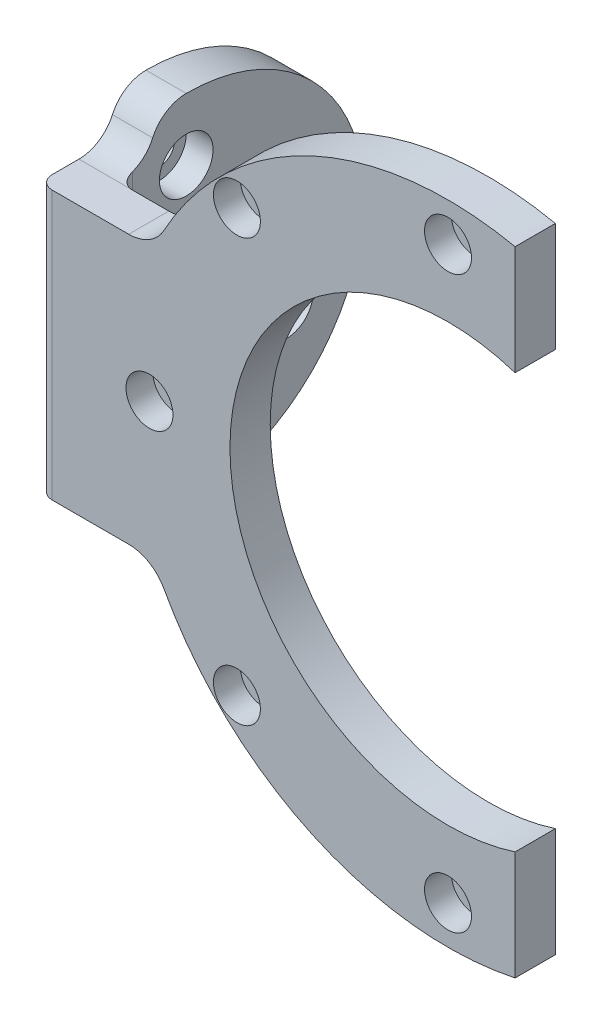
from build123d import *

# Parameters (mm, degrees)
SKETCH_3_R                   = 48.25
SKETCH_3_R_2                 = 32.5
EXTRUDE_2_DEPTH              = 3
SKETCH_5_R                   = 41.525287223
SKETCH_5_R_2                 = 39.197474278
EXTRUDE_3_DEPTH              = 0.1
EXTRUDE_START                = -3
SKETCH_2_R                   = 48.25
SKETCH_2_R_2                 = 32.5
EXTRUDE_1_DEPTH              = 3
EXTRUDE_5_DEPTH              = 3
EXTRUDE_5_DEPTH_BACK         = 2.98
HOLE_WIZARD_M3_5_1_D         = 2.9
EXTRUDE_7_DEPTH              = 4
EXTRUDE_7_DEPTH_BACK         = 2
CUT_EXTRUDE_10_DEPTH         = 88.222318818
CUT_EXTRUDE_10_DEPTH_BACK    = 88.222318818
HOLE_WIZARD_M4_3_D           = 4.5
HOLE_WIZARD_M4_3_CBORE_D     = 8
HOLE_WIZARD_M4_3_CBORE_DEPTH = 4
FILLET_1_R                   = 2
CUT_EXTRUDE_11_DEPTH         = 10
CUT_EXTRUDE_11_DEPTH_BACK    = 10
FILLET_2_R                   = 3
SKETCH_33_R                  = 3.5
CUT_EXTRUDE_12_DEPTH         = 4
FILLET_5_R                   = 2


with BuildPart() as part:
    # 草图3 → 凸台-拉伸2 (new body)
    with BuildSketch(Plane.XY):
        Circle(SKETCH_3_R)
        Circle(SKETCH_3_R_2, mode=Mode.SUBTRACT)
    extrude(amount=EXTRUDE_2_DEPTH)

    # 草图5 → 凸台-拉伸3 (add)
    with BuildSketch(Plane.XY.offset(3)):
        Circle(SKETCH_5_R)
        Circle(SKETCH_5_R_2, mode=Mode.SUBTRACT)
    extrude(amount=-EXTRUDE_3_DEPTH)

    # 草图2 → 凸台-拉伸1 (add)
    with BuildSketch(Plane.XY.offset(EXTRUDE_START)):
        Circle(SKETCH_2_R)
        Circle(SKETCH_2_R_2, mode=Mode.SUBTRACT)
    extrude(amount=EXTRUDE_1_DEPTH)

    # 草图8 → 凸台-拉伸5 (add, two sides: drawn at the far end of the back side and taken through both)
    with BuildSketch(Plane.XY.offset(-EXTRUDE_5_DEPTH_BACK)):
        with BuildLine():
            Line((-57, 20.010872518), (-47.592541309, 20.010872518))
            ThreePointArc((-47.592541309, 20.010872518), (-44.543901449, 20.847255835), (-42.348850377, 23.12222679))
            ThreePointArc((-42.348850377, 23.12222679), (-48.25, 0), (-42.348850377, -23.12222679))
            ThreePointArc((-42.348850377, -23.12222679), (-44.543901449, -20.847255835), (-47.592541309, -20.010872518))
            Line((-47.592541309, -20.010872518), (-57, -20.010872518))
            Line((-57, -20.010872518), (-57, 20.010872518))
        make_face()
    extrude(amount=EXTRUDE_5_DEPTH + EXTRUDE_5_DEPTH_BACK)

    # M3.5 螺纹孔的螺纹孔钻头1 (through all)
    with Locations(Plane(origin=(31.466251763, 31.466251763, 3), x_dir=(1, 0, 0), z_dir=(0, 0, 1))):
        with Locations((0, 0), (13.033748237, -31.466251763), (0, -62.932503526), (-62.932503526, -62.932503526), (-75.966251763, -31.466251763), (-62.932503526, 0), (-31.466251763, -73.966251763), (-31.466251763, 11.033748237)):
            Hole(HOLE_WIZARD_M3_5_1_D / 2)

    # 草图26 → 凸台-拉伸7 (add, two sides: drawn at the far end of the back side and taken through both)
    with BuildSketch(Plane.ZY.offset(57).offset(-EXTRUDE_7_DEPTH_BACK)):
        with BuildLine():
            ThreePointArc((-12.98, 26.5), (-39.48, 0), (-12.98, -26.5))
            ThreePointArc((-12.98, -26.5), (-9.999377331, -25.617338519), (-7.98, -23.254010785))
            ThreePointArc((-7.98, -23.254010785), (-5.960622669, -20.89068305), (-2.98, -20.008021569))
            Line((-2.98, -20.008021569), (3, -20.008021569))
            Line((3, -20.008021569), (3, 20.010872518))
            Line((3, 20.010872518), (-2.98, 20.010872518))
            ThreePointArc((-2.98, 20.010872518), (-5.959846717, 20.892654018), (-7.98, 23.254010785))
            ThreePointArc((-7.98, 23.254010785), (-10.000085555, 25.616247597), (-12.98, 26.5))
        make_face()
    extrude(amount=EXTRUDE_7_DEPTH + EXTRUDE_7_DEPTH_BACK)

    # 草图27 → 切除-拉伸10 (cut, two sides: drawn at the far end of the back side and taken through both)
    with BuildSketch(Plane.XY.offset(-CUT_EXTRUDE_10_DEPTH_BACK)):
        with BuildLine():
            Line((10, -47.202356933), (10, 47.202356933))
            ThreePointArc((10, 47.202356933), (48.25, 0), (10, -47.202356933))
        make_face()
    extrude(amount=CUT_EXTRUDE_10_DEPTH + CUT_EXTRUDE_10_DEPTH_BACK, mode=Mode.SUBTRACT)

    # M4 六角凹头盖的柱孔3 (through all)
    with Locations(Plane(origin=(-55, 17.25, -12.98), x_dir=(0, 0, 1), z_dir=(1, 0, 0))):
        with Locations((0, 0), (-14.938938215, 8.625), (-14.938938215, 25.875), (0, 34.5)):
            CounterBoreHole(HOLE_WIZARD_M4_3_D / 2, HOLE_WIZARD_M4_3_CBORE_D / 2, HOLE_WIZARD_M4_3_CBORE_DEPTH)

    # 圆角1
    fillet_1_edges = [part.edges().sort_by_distance(p)[0] for p in [
        (-61, 0.001425474, 3),
    ]]
    fillet(fillet_1_edges, radius=FILLET_1_R)

    # 草图30 → 切除-拉伸11 (cut, two sides: drawn at the far end of the back side and taken through both)
    with BuildSketch(Plane.ZY.offset(57).offset(-CUT_EXTRUDE_11_DEPTH_BACK)):
        with BuildLine():
            Line((-12.98, 8.39165306), (-12.98, -8.39165306))
            ThreePointArc((-12.98, -8.39165306), (-21.37165306, 0), (-12.98, 8.39165306))
        make_face()
    extrude(amount=CUT_EXTRUDE_11_DEPTH + CUT_EXTRUDE_11_DEPTH_BACK, mode=Mode.SUBTRACT)

    # 圆角2
    fillet_2_edges = [part.edges().sort_by_distance(p)[0] for p in [
        (-58, -8.39165306, -12.98),
        (-58, 8.39165306, -12.98),
    ]]
    fillet(fillet_2_edges, radius=FILLET_2_R)

    # 草图33 → 切除-拉伸12 (cut)
    with BuildSketch(Plane.XY.offset(3)):
        with Locations((0, 42.5)):
            Circle(SKETCH_33_R)
        with Locations((0, -42.5)):
            Circle(SKETCH_33_R)
        with Locations((-31.466251763, 31.466251763)):
            Circle(SKETCH_33_R)
        with Locations((-44.5, 0)):
            Circle(SKETCH_33_R)
        with Locations((-31.466251763, -31.466251763)):
            Circle(SKETCH_33_R)
    extrude(amount=-CUT_EXTRUDE_12_DEPTH, mode=Mode.SUBTRACT)

    # 圆角5
    # the kernel refuses this fillet: 2 mm, written as the material it adds along each edge
    with BuildSketch(Plane(origin=(-55, -25.008021569, -2.98), x_dir=(0, 0, -1), z_dir=(0, 1, 0))) as fillet_5_piece_1_section:
        with BuildLine():
            CenterArc((FILLET_5_R, -FILLET_5_R), FILLET_5_R, 90, 90)
            Line((0, -FILLET_5_R), (0, 0))
            Line((0, 0), (FILLET_5_R, 0))
        make_face()
    fillet_5_piece_1 = extrude(amount=50.018894088, mode=Mode.PRIVATE)
    fillet_5_piece_1 = fillet_5_piece_1 - Plane(origin=(-54.891551476, 25.486733073, -2.98), x_dir=(0, -1, 0), z_dir=(1, 0, 0)) * Cylinder(5.475860555, 109, mode=Mode.PRIVATE)
    fillet_5_piece_1 = fillet_5_piece_1 - Plane(origin=(-54.891551476, -25.481922379, -2.98), x_dir=(0, 0.40700620484751754, -0.9134253933494627), z_dir=(1, 0, 0)) * Cylinder(5.473900809, 109, mode=Mode.PRIVATE)
    add(fillet_5_piece_1)


solid = part.part
